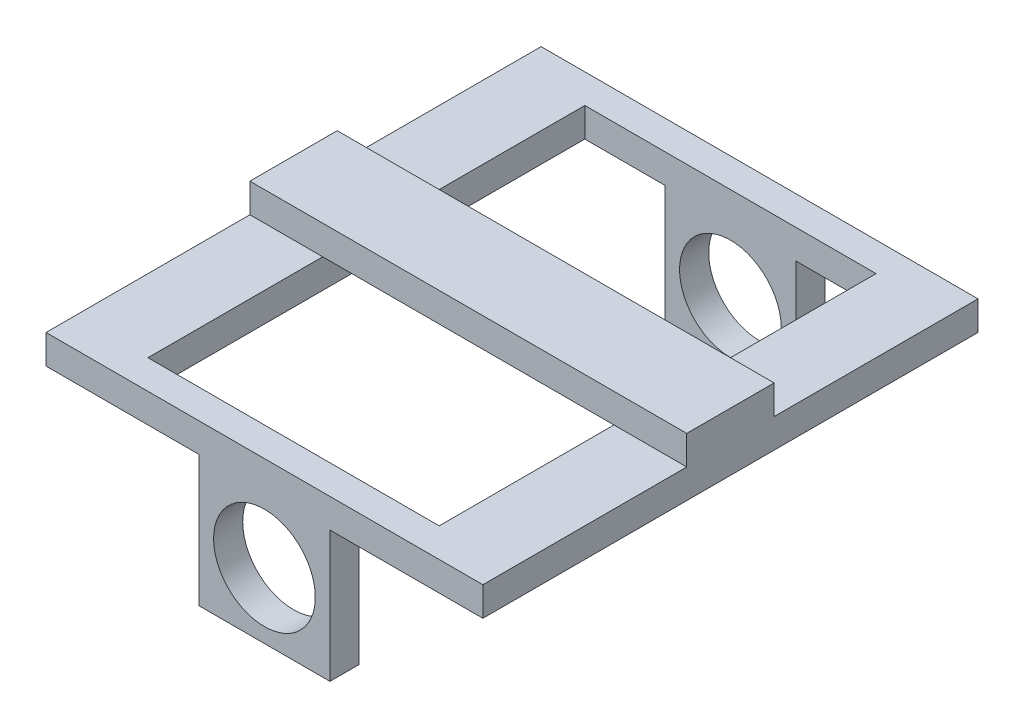
from build123d import *

# Parameters (mm, degrees)
SKETCH1_W               = 150
SKETCH1_H               = 30
BOSS_EXTRUDE1_DEPTH     = 10
SKETCH9_W               = 150
SKETCH9_H               = 170
SKETCH9_W_2             = 100
SKETCH9_H_2             = 150
BOSS_EXTRUDE3_DEPTH     = 10
SKETCH22_W              = 45
SKETCH22_H              = 10
BOSS_EXTRUDE4_DEPTH     = 45
CUT_EXTRUDE1_DEPTH      = 234.291662946
CUT_EXTRUDE1_DEPTH_BACK = 234.291662946
SKETCH24_R              = 17.4625


with BuildPart() as part:
    # Sketch1 → Boss-Extrude1 (new body)
    with BuildSketch(Plane(origin=(0, 0, 0), x_dir=(1, 0, 0), z_dir=(0, 1, 0))):
        with Locations((-75, 15)):
            Rectangle(SKETCH1_W, SKETCH1_H)
    extrude(amount=BOSS_EXTRUDE1_DEPTH)

    # Sketch9 → Boss-Extrude3 (add)
    with BuildSketch(Plane.XZ):
        with Locations((-75, -15)):
            Rectangle(SKETCH9_W, SKETCH9_H)
        with Locations((-75, -15)):
            Rectangle(SKETCH9_W_2, SKETCH9_H_2, mode=Mode.SUBTRACT)
    extrude(amount=BOSS_EXTRUDE3_DEPTH)

    # Sketch22 → Boss-Extrude4 (add)
    with BuildSketch(Plane.XZ.offset(10)):
        with Locations((-75, 65)):
            Rectangle(SKETCH22_W, SKETCH22_H)
        with Locations((-75, -95)):
            Rectangle(SKETCH22_W, SKETCH22_H)
    extrude(amount=BOSS_EXTRUDE4_DEPTH)

    # Sketch24 → Cut-Extrude1 (cut, two sides: drawn at the far end of the back side and taken through both)
    with BuildSketch(Plane.XY.offset(70).offset(-CUT_EXTRUDE1_DEPTH_BACK)):
        with Locations((-75, -32.5)):
            Circle(SKETCH24_R)
    extrude(amount=CUT_EXTRUDE1_DEPTH + CUT_EXTRUDE1_DEPTH_BACK, mode=Mode.SUBTRACT)


solid = part.part
